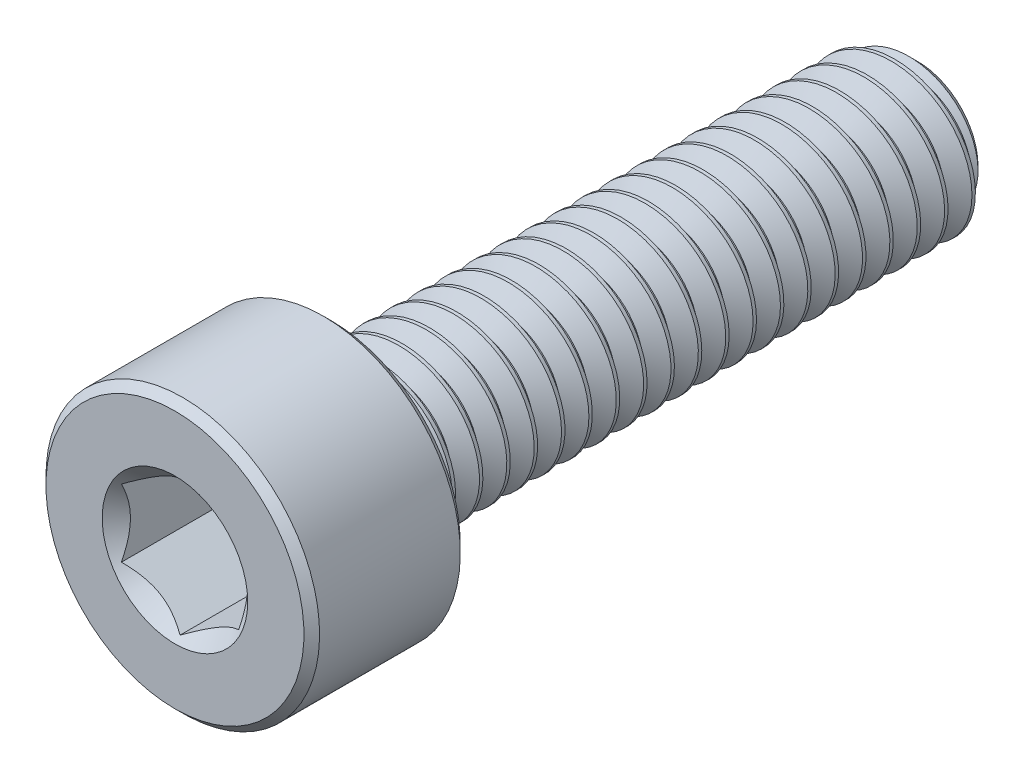
from build123d import *

# Parameters (mm, degrees)
CUT_EXTRUDE1_DEPTH     = 3
SPLIT1_SURFACE_1_BACK  = 22.424
SPLIT1_SURFACE_1_DEPTH = 44.848
SPLIT1_SURFACE_2_BACK  = 22.424
SPLIT1_SURFACE_2_DEPTH = 44.848
CUT_SWEEP1_PITCH       = 0.7
CUT_SWEEP1_TO          = 14.8


with BuildPart() as part:
    # Sketch2 → Revolve1 (revolve)
    with BuildSketch(Plane(origin=(0, 0, 0), x_dir=(0, 0, -1), z_dir=(1, 0, 0))):
        with BuildLine():
            Line((-9.5, 0), (-9.5, 3.3))
            Line((-9.5, 3.3), (-9.3, 3.5))
            Line((-9.3, 3.5), (-5.7, 3.5))
            Line((-5.7, 3.5), (-5.5, 3.3))
            Line((-5.5, 3.3), (-5.5, 2.2))
            ThreePointArc((-5.5, 2.2), (-5.441421356, 2.058578644), (-5.3, 2))
            Line((-5.3, 2), (9.045336663, 2))
            Line((9.045336663, 2), (9.5, 1.545336663))
            Line((9.5, 1.545336663), (9.5, 0))
            Line((9.5, 0), (-9.5, 0))
        make_face()
    revolve(axis=Axis((0, 0, -9.5), (0, 0, 1)))

    # Sketch3 → Cut-Extrude1 (cut)
    with BuildSketch(Plane.XY.offset(9.5)):
        Polygon((1.5, -0.866025404), (1.5, 0.866025404), (0, 1.732050808), (-1.5, 0.866025404), (-1.5, -0.866025404), (0, -1.732050808), align=None)
    extrude(amount=-CUT_EXTRUDE1_DEPTH, mode=Mode.SUBTRACT)

    # Cut-Extrude2 cone 1 section (through the dimple's axis) → Cut-Extrude2 (revolve, cut)
    with BuildSketch(Plane(origin=(0, 0, 9.5), x_dir=(0, -1, 0), z_dir=(1, 0, 0))):
        Polygon((0, 0), (1.861954618, 0), (0, 1.861954618), align=None)
    revolve(axis=Axis((0, 0, 9.5), (0, 0, -1)), mode=Mode.SUBTRACT)


with BuildPart() as body_2:
    # Split1: the piece behind the surface
    add(part.part)
    # Split1 surface: a surface, the sketch's curves swept straight by 44.848 mm
    with BuildLine(Plane(origin=(0, 0, 0), x_dir=(0, 0, -1), z_dir=(1, 0, 0)).offset(-SPLIT1_SURFACE_1_BACK), mode=Mode.PRIVATE) as split1_surface_1_path:
        Line((-5.3, -3.5), (-5.3, 3.5))
    split1_surface_1 = Shell.extrude(split1_surface_1_path.wire(), (1 * SPLIT1_SURFACE_1_DEPTH, 0 * SPLIT1_SURFACE_1_DEPTH, 0 * SPLIT1_SURFACE_1_DEPTH))
    split(bisect_by=split1_surface_1, keep=Keep.BOTTOM)

    # Cut-Sweep1: arcs per turn and ends read off the stored shape
    # Cut-Sweep1: the profile of Sketch7 screwed along a right-hand helix through 22.428571 turns, 6 arcs to a turn; built about Z, then put on its axis
    cut_sweep1_z = Axis((0, 0, 0), (0, 0, 1))
    cut_sweep1_corners = [(2.037888611, 0, 0.021875), (2.037888611, 0, -0.634375), (1.545336663, 0, -0.35), (1.545336663, 0, -0.2625)]
    with BuildLine(mode=Mode.PRIVATE) as cut_sweep1_profile:
        Line(cut_sweep1_corners[0], cut_sweep1_corners[1])
        Line(cut_sweep1_corners[1], cut_sweep1_corners[2])
        Line(cut_sweep1_corners[2], cut_sweep1_corners[3])
        Line(cut_sweep1_corners[3], cut_sweep1_corners[0])
    cut_sweep1_cap = Face(cut_sweep1_profile.wire())
    cut_sweep1_turn_angles = [0, 30, 60, 90, 120, 150, 180, 210, 240, 270, 300, 330, 360]
    cut_sweep1_turn_weights = [1, 0.8660254037844387, 1, 0.8660254037844387, 1, 0.8660254037844387, 1, 0.8660254037844387, 1, 0.8660254037844387, 1, 0.8660254037844387, 1]
    cut_sweep1_turn_rails = [Edge.make_bspline([Vector(p[0], p[1], 0).rotate(cut_sweep1_z, cut_sweep1_turn_angles[k]) / cut_sweep1_turn_weights[k] + Vector(0, 0, p[2] + CUT_SWEEP1_PITCH * cut_sweep1_turn_angles[k] / 360) for k in range(13)], [0, 0, 0, 1, 1, 2, 2, 3, 3, 4, 4, 5, 5, 6, 6, 6], 2, cut_sweep1_turn_weights) for p in cut_sweep1_corners]
    cut_sweep1_turn_sides = [Face.make_surface_from_curves(cut_sweep1_turn_rails[p[0]], cut_sweep1_turn_rails[p[1]]) for p in [(0, 1), (1, 2), (2, 3), (3, 0)]]
    cut_sweep1_last_angles = [7920, 7950, 7980, 8010, 8040, 8057.142857143, 8074.285714286]
    cut_sweep1_last_weights = [1, 0.8660254037844387, 1, 0.8660254037844387, 1, 0.9555728057859783, 1]
    cut_sweep1_last_rails = [Edge.make_bspline([Vector(p[0], p[1], 0).rotate(cut_sweep1_z, cut_sweep1_last_angles[k]) / cut_sweep1_last_weights[k] + Vector(0, 0, p[2] + CUT_SWEEP1_PITCH * cut_sweep1_last_angles[k] / 360) for k in range(7)], [0, 0, 0, 1, 1, 2, 2, 3, 3, 3], 2, cut_sweep1_last_weights) for p in cut_sweep1_corners]
    cut_sweep1_last_sides = [Face.make_surface_from_curves(cut_sweep1_last_rails[p[0]], cut_sweep1_last_rails[p[1]]) for p in [(0, 1), (1, 2), (2, 3), (3, 0)]]
    cut_sweep1 = Plane(origin=(0, 0, -9.5), x_dir=(0, 1, 0), z_dir=(0, 0, 1)) * split(Solid(Shell([*[p.moved(Location((0, 0, CUT_SWEEP1_PITCH * i))) for i in range(22) for p in cut_sweep1_turn_sides], *cut_sweep1_last_sides, cut_sweep1_cap, cut_sweep1_cap.rotate(cut_sweep1_z, 8074.285714286).moved(Location((0, 0, CUT_SWEEP1_PITCH * 8074.285714286 / 360)))])), bisect_by=Plane.XY.offset(CUT_SWEEP1_TO), keep=Keep.BOTTOM, mode=Mode.PRIVATE)
    add(cut_sweep1, mode=Mode.SUBTRACT)


with BuildPart() as part_1:
    add(part.part)

    # Split1: split by a surface, the side it looks to stays
    # Split1 surface: a surface, the sketch's curves swept straight by 44.848 mm
    with BuildLine(Plane(origin=(0, 0, 0), x_dir=(0, 0, -1), z_dir=(1, 0, 0)).offset(-SPLIT1_SURFACE_2_BACK), mode=Mode.PRIVATE) as split1_surface_2_path:
        Line((-5.3, -3.5), (-5.3, 3.5))
    split1_surface_2 = Shell.extrude(split1_surface_2_path.wire(), (1 * SPLIT1_SURFACE_2_DEPTH, 0 * SPLIT1_SURFACE_2_DEPTH, 0 * SPLIT1_SURFACE_2_DEPTH))
    split(bisect_by=split1_surface_2, keep=Keep.TOP)

    add(body_2.part)  # Revolve2 merges body 2
    # Sketch8 → Revolve2 (revolve)
    with BuildSketch(Plane(origin=(0, 0, 0), x_dir=(0, 0, -1), z_dir=(1, 0, 0)), mode=Mode.PRIVATE) as revolve2_sk:
        Polygon((-5.5, 0), (-5.5, 2), (-5.3, 2), (-4.145299462, 0), align=None)
    revolve(revolve2_sk.sketch.rotate(Axis((0, 0, 4.145299462), (0, 0, 1)), 270), axis=Axis((0, 0, 4.145299462), (0, 0, 1)))


solid = part_1.part
